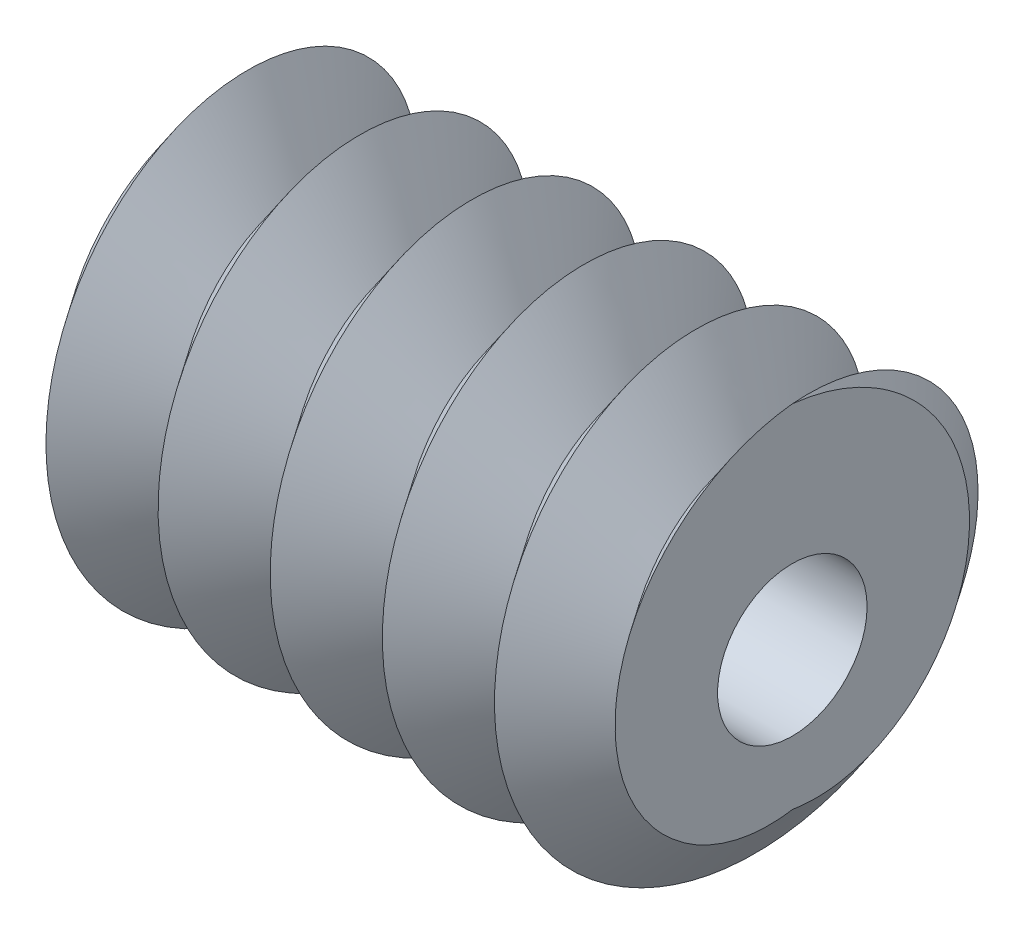
from build123d import *
from build123d.topology import SkipClean

# Parameters (mm, degrees)
SKETCH1_R           = 2.85
SKETCH1_R_2         = 1
BOSS_EXTRUDE1_DEPTH = 7.85
CUT_SWEEP3_PITCH    = 1.5


with BuildPart() as part:
    # Sketch1 → Boss-Extrude1 (new body)
    with BuildSketch(Plane(origin=(0, 0, 0), x_dir=(0, 0, -1), z_dir=(1, 0, 0))):
        Circle(SKETCH1_R)
        Circle(SKETCH1_R_2, mode=Mode.SUBTRACT)
    extrude(amount=BOSS_EXTRUDE1_DEPTH)

    # Cut-Sweep3: the profile of Sketch3 screwed along a right-hand helix of 6.5 turns, 8 arcs to a turn; built about Z, then put on its axis
    with SkipClean():  # the faces are left unmerged after this step: merging them gives an invalid solid
        cut_sweep3_z = Axis((0, 0, 0), (0, 0, 1))
        cut_sweep3_corners = [(2.85, 0, 0), (1.85, 0, -0.75), (2.85, 0, -1.5), (3.101496865, 0, -1.5), (3.101496865, 0, 0)]
        with BuildLine(mode=Mode.PRIVATE) as cut_sweep3_profile:
            Line(cut_sweep3_corners[0], cut_sweep3_corners[1])
            Line(cut_sweep3_corners[1], cut_sweep3_corners[2])
            Line(cut_sweep3_corners[2], cut_sweep3_corners[3])
            Line(cut_sweep3_corners[3], cut_sweep3_corners[4])
            Line(cut_sweep3_corners[4], cut_sweep3_corners[0])
        cut_sweep3_cap = Face(cut_sweep3_profile.wire())
        cut_sweep3_turn_angles = [0, 22.5, 45, 67.5, 90, 112.5, 135, 157.5, 180, 202.5, 225, 247.5, 270, 292.5, 315, 337.5, 360]
        cut_sweep3_turn_weights = [1, 0.9238795325112867, 1, 0.9238795325112867, 1, 0.9238795325112867, 1, 0.9238795325112867, 1, 0.9238795325112867, 1, 0.9238795325112867, 1, 0.9238795325112867, 1, 0.9238795325112867, 1]
        cut_sweep3_turn_rails = [Edge.make_bspline([Vector(p[0], p[1], 0).rotate(cut_sweep3_z, cut_sweep3_turn_angles[k]) / cut_sweep3_turn_weights[k] + Vector(0, 0, p[2] + CUT_SWEEP3_PITCH * cut_sweep3_turn_angles[k] / 360) for k in range(17)], [0, 0, 0, 1, 1, 2, 2, 3, 3, 4, 4, 5, 5, 6, 6, 7, 7, 8, 8, 8], 2, cut_sweep3_turn_weights) for p in cut_sweep3_corners]
        cut_sweep3_turn_sides = [Face.make_surface_from_curves(cut_sweep3_turn_rails[p[0]], cut_sweep3_turn_rails[p[1]]) for p in [(0, 1), (1, 2), (2, 3), (3, 4), (4, 0)]]
        cut_sweep3_turn = Solid(Shell([*cut_sweep3_turn_sides, cut_sweep3_cap, cut_sweep3_cap.rotate(cut_sweep3_z, 360).moved(Location((0, 0, CUT_SWEEP3_PITCH * 360 / 360)))]))
        cut_sweep3_last_angles = [2160, 2182.5, 2205, 2227.5, 2250, 2272.5, 2295, 2317.5, 2340]
        cut_sweep3_last_weights = [1, 0.9238795325112867, 1, 0.9238795325112867, 1, 0.9238795325112867, 1, 0.9238795325112442, 1]
        cut_sweep3_last_rails = [Edge.make_bspline([Vector(p[0], p[1], 0).rotate(cut_sweep3_z, cut_sweep3_last_angles[k]) / cut_sweep3_last_weights[k] + Vector(0, 0, p[2] + CUT_SWEEP3_PITCH * cut_sweep3_last_angles[k] / 360) for k in range(9)], [0, 0, 0, 1, 1, 2, 2, 3, 3, 4, 4, 4], 2, cut_sweep3_last_weights) for p in cut_sweep3_corners]
        cut_sweep3_last_sides = [Face.make_surface_from_curves(cut_sweep3_last_rails[p[0]], cut_sweep3_last_rails[p[1]]) for p in [(0, 1), (1, 2), (2, 3), (3, 4), (4, 0)]]
        cut_sweep3_last = Solid(Shell([*cut_sweep3_last_sides, cut_sweep3_cap.rotate(cut_sweep3_z, 2160).moved(Location((0, 0, CUT_SWEEP3_PITCH * 2160 / 360))), cut_sweep3_cap.rotate(cut_sweep3_z, 2340).moved(Location((0, 0, CUT_SWEEP3_PITCH * 2340 / 360)))]))
        cut_sweep3_each = [*[cut_sweep3_turn.moved(Location((0, 0, CUT_SWEEP3_PITCH * i))) for i in range(6)], cut_sweep3_last]
        add(Plane(origin=(7.85, 0, 0), x_dir=(0, 1, 0), z_dir=(-1, 0, 0)) * Compound([cut_sweep3_each[i] for i in range(0, 7, 2)]), mode=Mode.SUBTRACT)
        add(Plane(origin=(7.85, 0, 0), x_dir=(0, 1, 0), z_dir=(-1, 0, 0)) * Compound([cut_sweep3_each[i] for i in range(1, 7, 2)]), mode=Mode.SUBTRACT)


solid = part.part
